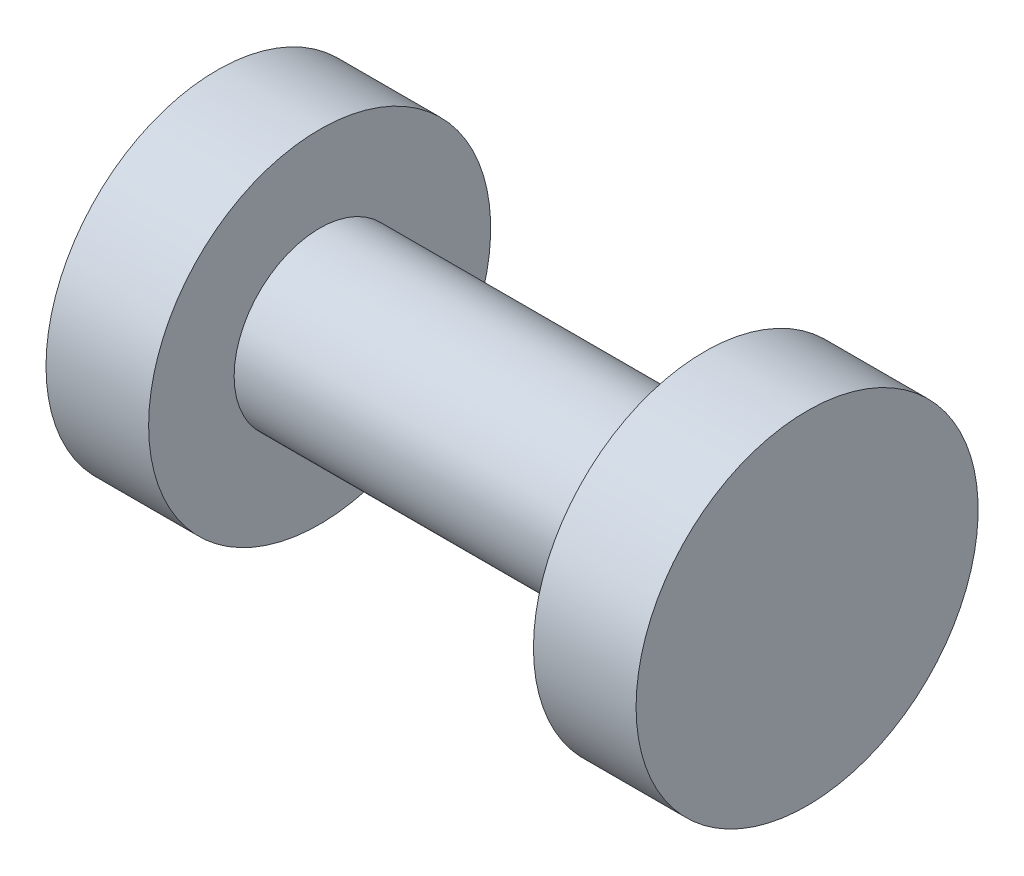
from build123d import *


with BuildPart() as part:
    # Sketch1 → Revolve1 (revolve)
    with BuildSketch(Plane(origin=(0, 0, 0), x_dir=(1, 0, 0), z_dir=(0, 1, 0))):
        Polygon((-10.95375, 6.35), (-7.14375, 6.35), (-7.14375, 3.175), (7.14375, 3.175), (7.14375, 6.35), (10.95375, 6.35), (10.95375, 0), (-10.95375, 0), align=None)
    revolve(axis=Axis((-10.95375, 0, 0), (1, 0, 0)))


solid = part.part
